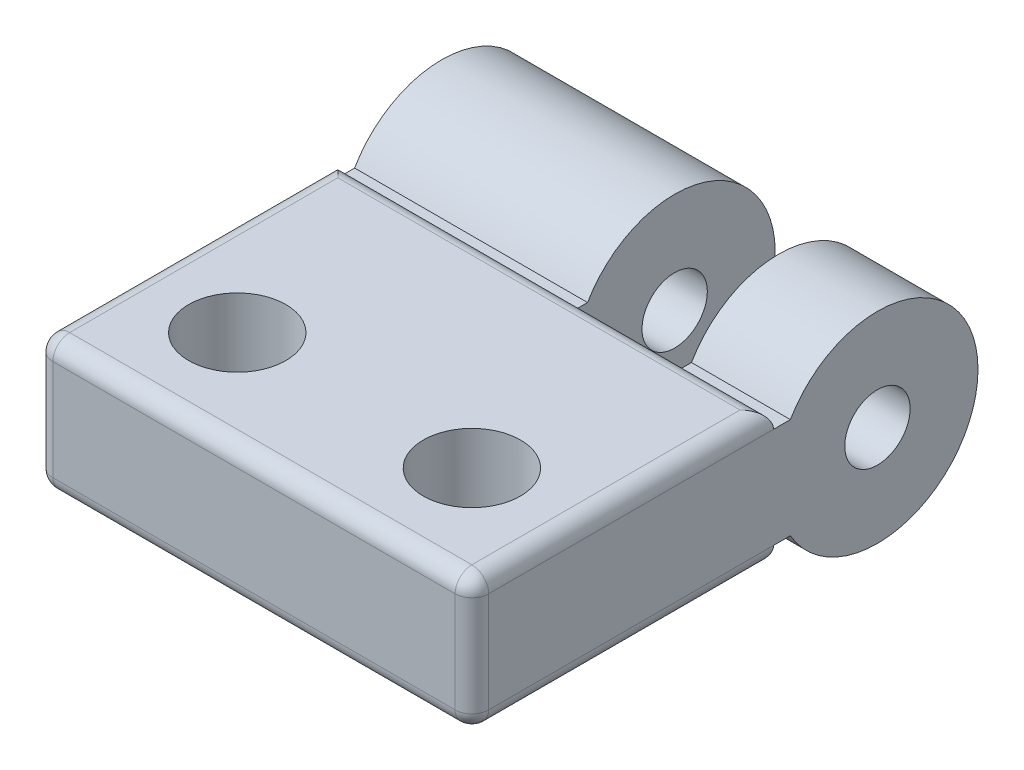
from build123d import *

# Parameters (mm, degrees)
SKETCH1_W           = 9
SKETCH1_H           = 9
BOSS_EXTRUDE1_DEPTH = 3
SKETCH2_W           = 2.95
SKETCH2_H           = 6
BOSS_EXTRUDE2_DEPTH = 6.1
FILLET1_R           = 3
SKETCH3_R           = 0.975
CUT_EXTRUDE1_DEPTH  = 11.1
CUT_EXTRUDE3_DEPTH  = 21.1
BOSS_EXTRUDE3_START = 4
SKETCH5_R           = 3
BOSS_EXTRUDE3_DEPTH = 4
SKETCH8_R           = 1.55
CUT_EXTRUDE4_DEPTH  = 5
CUT_EXTRUDE5_DEPTH  = 0.5
BOSS_EXTRUDE4_START = 4
BOSS_EXTRUDE4_DEPTH = 4
BOSS_EXTRUDE5_DEPTH = 0.5
BOSS_EXTRUDE6_DEPTH = 0.5
SKETCH15_W          = 0.501923789
SKETCH15_H          = 0.5
CUT_EXTRUDE6_DEPTH  = 19.5
SKETCH16_R          = 1.45
CUT_EXTRUDE7_DEPTH  = 19.5
FILLET2_R           = 0.5


with BuildPart() as part:
    # Sketch1 → Boss-Extrude1 (new body)
    with BuildSketch(Plane(origin=(0, 0, 0), x_dir=(1, 0, 0), z_dir=(0, 1, 0))):
        with Locations((4.5, 4.5)):
            Rectangle(SKETCH1_W, SKETCH1_H)
    extrude(amount=BOSS_EXTRUDE1_DEPTH)

    # Sketch2 → Boss-Extrude2 (add)
    with BuildSketch(Plane(origin=(0, 0, -9), x_dir=(-1, 0, 0), z_dir=(0, 0, -1))):
        with Locations((-7.525, 1.5)):
            Rectangle(SKETCH2_W, SKETCH2_H)
        with Locations((-1.475, 1.5)):
            Rectangle(SKETCH2_W, SKETCH2_H)
    extrude(amount=BOSS_EXTRUDE2_DEPTH)

    # Fillet1
    fillet1_edges = [part.edges().sort_by_distance(p)[0] for p in [
        (1.475, 4.5, -15.1),
        (1.475, -1.5, -15.1),
        (7.525, -1.5, -15.1),
        (7.525, 4.5, -15.1),
    ]]
    fillet(fillet1_edges, radius=FILLET1_R - 0.0001)  # a hair under: the kernel refuses the full size

    # Sketch3 → Cut-Extrude1 (cut)
    with BuildSketch(Plane(origin=(9, 0, 0), x_dir=(0, 0, -1), z_dir=(1, 0, 0))):
        with Locations((12.1, 1.5)):
            Circle(SKETCH3_R)
    extrude(amount=-CUT_EXTRUDE1_DEPTH, mode=Mode.SUBTRACT)

    # Sketch6 → Cut-Extrude3 (cut)
    with BuildSketch(Plane.ZY):
        with BuildLine():
            Line((-12.1, 4.5), (-9, 4.5))
            Line((-9, 4.5), (-9, 3))
            Line((-9, 3), (-9.501923789, 3))
            ThreePointArc((-9.501923789, 3), (-10.6, 4.098076211), (-12.1, 4.5))
        make_face()
        with BuildLine():
            Line((-12.1, -1.5), (-9, -1.5))
            Line((-9, -1.5), (-9, 0))
            Line((-9, 0), (-9.501923789, 0))
            ThreePointArc((-9.501923789, 0), (-10.6, -1.098076211), (-12.1, -1.5))
        make_face()
    extrude(amount=-CUT_EXTRUDE3_DEPTH, mode=Mode.SUBTRACT)

    # Sketch5 → Boss-Extrude3 (add)
    with BuildSketch(Plane.ZY.offset(BOSS_EXTRUDE3_START)):
        with Locations((-12.1, 1.5)):
            Circle(SKETCH5_R)
    extrude(amount=-BOSS_EXTRUDE3_DEPTH)

    # Sketch8 → Cut-Extrude4 (cut)
    with BuildSketch(Plane(origin=(0, -1.5, 0), x_dir=(-1, 0, 0), z_dir=(0, -1, 0))):
        with Locations(Location((1.6, 12.1, 0), (0, 0, 90))):
            Circle(SKETCH8_R)
    extrude(amount=-CUT_EXTRUDE4_DEPTH, mode=Mode.SUBTRACT)

    # Sketch9 → Cut-Extrude5 (cut)
    with BuildSketch(Plane.ZY.offset(4)):
        with BuildLine():
            Line((-11.85, 1.5), (-11.85, -0.8))
            ThreePointArc((-11.85, -0.8), (-12.1, -1.05), (-12.35, -0.8))
            Line((-12.35, -0.8), (-12.35, 0.896446609))
            Line((-12.35, 0.896446609), (-13.549568901, -0.303122292))
            ThreePointArc((-13.549568901, -0.303122292), (-13.903122292, -0.303122292), (-13.903122292, 0.050431099))
            Line((-13.903122292, 0.050431099), (-12.703553391, 1.25))
            Line((-12.703553391, 1.25), (-14.4, 1.25))
            ThreePointArc((-14.4, 1.25), (-14.65, 1.5), (-14.4, 1.75))
            Line((-14.4, 1.75), (-12.703553391, 1.75))
            Line((-12.703553391, 1.75), (-13.903122292, 2.949568901))
            ThreePointArc((-13.903122292, 2.949568901), (-13.903122292, 3.303122292), (-13.549568901, 3.303122292))
            Line((-13.549568901, 3.303122292), (-12.35, 2.103553391))
            Line((-12.35, 2.103553391), (-12.35, 3.8))
            ThreePointArc((-12.35, 3.8), (-12.1, 4.05), (-11.85, 3.8))
            Line((-11.85, 3.8), (-11.85, 1.5))
        make_face()
    extrude(amount=-CUT_EXTRUDE5_DEPTH, mode=Mode.SUBTRACT)

    # Sketch10 → Boss-Extrude4 (add)
    with BuildSketch(Plane.ZY.offset(BOSS_EXTRUDE4_START)):
        with BuildLine():
            Line((-9.501923789, 0), (0, 0))
            Line((0, 0), (0, 3))
            Line((0, 3), (-9.501923789, 3))
            ThreePointArc((-9.501923789, 3), (-9.1, 1.5), (-9.501923789, 0))
        make_face()
    extrude(amount=-BOSS_EXTRUDE4_DEPTH)

    # Sketch12 → Boss-Extrude5 (add)
    with BuildSketch(Plane.XZ):
        Polygon((9, 0), (-4, 0), (-4, -9.501923789), (2.95, -9.501923789), (2.95, -9), (6.05, -9), (6.05, -9.501923789), (9, -9.501923789), align=None)
    extrude(amount=BOSS_EXTRUDE5_DEPTH)

    # Sketch13 → Boss-Extrude6 (add)
    with BuildSketch(Plane(origin=(0, 3, 0), x_dir=(1, 0, 0), z_dir=(0, 1, 0))):
        Polygon((2.95, 9.501923789), (-4, 9.501923789), (-4, 0), (9, 0), (9, 9.501923789), (6.05, 9.501923789), (6.05, 9), (2.95, 9), align=None)
    extrude(amount=BOSS_EXTRUDE6_DEPTH)

    # Sketch15 → Cut-Extrude6 (cut)
    with BuildSketch(Plane(origin=(9, 0, 0), x_dir=(0, 0, -1), z_dir=(1, 0, 0))):
        with Locations((9.250961895, 3.25)):
            Rectangle(SKETCH15_W, SKETCH15_H)
        with Locations((9.250961895, -0.25)):
            Rectangle(SKETCH15_W, SKETCH15_H)
    extrude(amount=-CUT_EXTRUDE6_DEPTH, mode=Mode.SUBTRACT)

    # Sketch16 → Cut-Extrude7 (cut)
    with BuildSketch(Plane(origin=(0, 3.5, 0), x_dir=(1, 0, 0), z_dir=(0, 1, 0))):
        with Locations(Location((6, 3, 0), (0, 0, 270))):
            Circle(SKETCH16_R)
        with Locations(Location((-1, 3, 0), (0, 0, 90))):
            Circle(SKETCH16_R)
    extrude(amount=-CUT_EXTRUDE7_DEPTH, mode=Mode.SUBTRACT)

    # Fillet2
    fillet2_edges = [part.edges().sort_by_distance(p)[0] for p in [
        (2.5, 3.5, 0),
        (9, 1.25, 0),
        (2.5, -0.5, 0),
        (-4, 1.5, 0),
        (-4, -0.5, -4.5),
        (-4, 3.5, -4.5),
        (9, 3.5, -4.5),
        (9, -0.5, -4.5),
        (2.5, 3.5, -9),
        (2.5, -0.5, -9),
    ]]
    fillet(fillet2_edges, radius=FILLET2_R - 0.0001)  # a hair under: the kernel refuses the full size


solid = part.part
